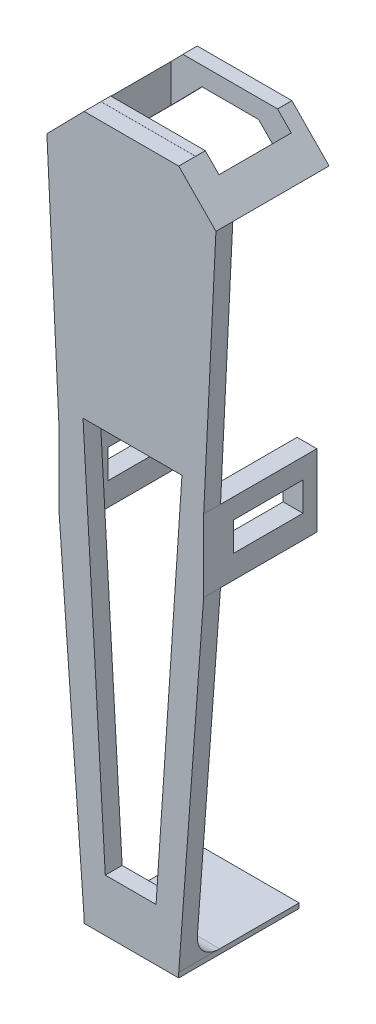
from build123d import *

# Parameters (mm, degrees)
BOSS_EXTRUDE1_DEPTH   = 40
SKETCH1_W             = 8.198494791
SKETCH1_H             = 30
BOSS_EXTRUDE1_2_DEPTH = 40
SKETCH1_W_2           = 7.801505209
BOSS_EXTRUDE1_3_DEPTH = 40
BOSS_EXTRUDE2_DEPTH   = 7
SKETCH3_W             = 39.29
SKETCH3_H             = 50
BOSS_EXTRUDE3_DEPTH   = 2
FILLET1_R             = 10
SKETCH4_W             = 28.841998226
SKETCH4_H             = 12
CUT_EXTRUDE1_DEPTH    = 200
SKETCH5_W             = 50
SKETCH5_H             = 30.008790532
CUT_EXTRUDE2_DEPTH    = 50
CUT_EXTRUDE3_DEPTH    = 30


with BuildPart() as part:
    # Sketch1 → Boss-Extrude1 (new body)
    with BuildSketch(Plane.XY):
        Polygon((-27.787096512, 25.913149565), (-27.787096512, 25.885892475), (-43.235049783, 10.14086318), (-35.355311996, 2.409799691), (-19.880615921, 18.182086076), (3.601216654, 18.182086076), (19.075912729, 2.409799691), (26.955650516, 10.14086318), (11.507697245, 25.885892475), (11.507697245, 25.913149565), align=None)
    extrude(amount=BOSS_EXTRUDE1_DEPTH)



with BuildPart() as body_2:
    # Sketch1 → Boss-Extrude1 2 (new body)
    with BuildSketch(Plane.XY):
        with Locations((17.76105297, -109.086850435)):
            Rectangle(SKETCH1_W, SKETCH1_H)
    extrude(amount=BOSS_EXTRUDE1_2_DEPTH)


with BuildPart() as body_3:
    # Sketch1 → Boss-Extrude1 3 (new body)
    with BuildSketch(Plane.XY):
        with Locations((-34.23894703, -109.086850435)):
            Rectangle(SKETCH1_W_2, SKETCH1_H)
    extrude(amount=BOSS_EXTRUDE1_3_DEPTH)


with BuildPart() as part_1:
    add(part.part)

    add(body_2.part)  # Boss-Extrude2 merges body 2

    add(body_3.part)  # Boss-Extrude2 merges body 3
    # Sketch2 → Boss-Extrude2 (add)
    with BuildSketch(Plane.XY.offset(40)):
        Polygon((-43.235049783, 10.14086318), (-38.139699634, -94.086850435), (-38.139699634, -124.086850435), (-27.787096512, -264.114107525), (11.507697245, -264.114107525), (21.860300366, -124.086850435), (21.860300366, -94.086850435), (26.955650516, 10.14086318), (11.507697245, 25.885892475), (-27.787096512, 25.885892475), align=None)
    extrude(amount=BOSS_EXTRUDE2_DEPTH)

    # Sketch3 → Boss-Extrude3 (add)
    with BuildSketch(Plane.XZ.offset(264.114107525)):
        with Locations((-8.137302755, 22)):
            Rectangle(SKETCH3_W, SKETCH3_H)
    extrude(amount=BOSS_EXTRUDE3_DEPTH)

    # Fillet1
    fillet1_edges = [part_1.edges().sort_by_distance(p)[0] for p in [
        (-8.137302755, -264.114107525, 40),
    ]]
    fillet(fillet1_edges, radius=FILLET1_R)

    # Sketch4 → Cut-Extrude1 (cut)
    with BuildSketch(Plane.ZY.offset(38.139699634)):
        with Locations((20.187288549, -108.429522733)):
            Rectangle(SKETCH4_W, SKETCH4_H)
    extrude(amount=-CUT_EXTRUDE1_DEPTH, mode=Mode.SUBTRACT)

    # Sketch5 → Cut-Extrude2 (cut)
    with BuildSketch(Plane(origin=(0, 25.913149565, 0), x_dir=(1, 0, 0), z_dir=(0, 1, 0))):
        with Locations((-7.813085756, -20.959154247)):
            Rectangle(SKETCH5_W, SKETCH5_H)
    extrude(amount=-CUT_EXTRUDE2_DEPTH, mode=Mode.SUBTRACT)

    # Sketch6 → Cut-Extrude3 (cut)
    with BuildSketch(Plane.XY.offset(47)):
        Polygon((-18.988569428, -244.37242015), (2.088013763, -244.37242015), (12.854125257, -84.649157045), (-28.237577982, -84.649157045), align=None)
    extrude(amount=-CUT_EXTRUDE3_DEPTH, mode=Mode.SUBTRACT)


solid = part_1.part
